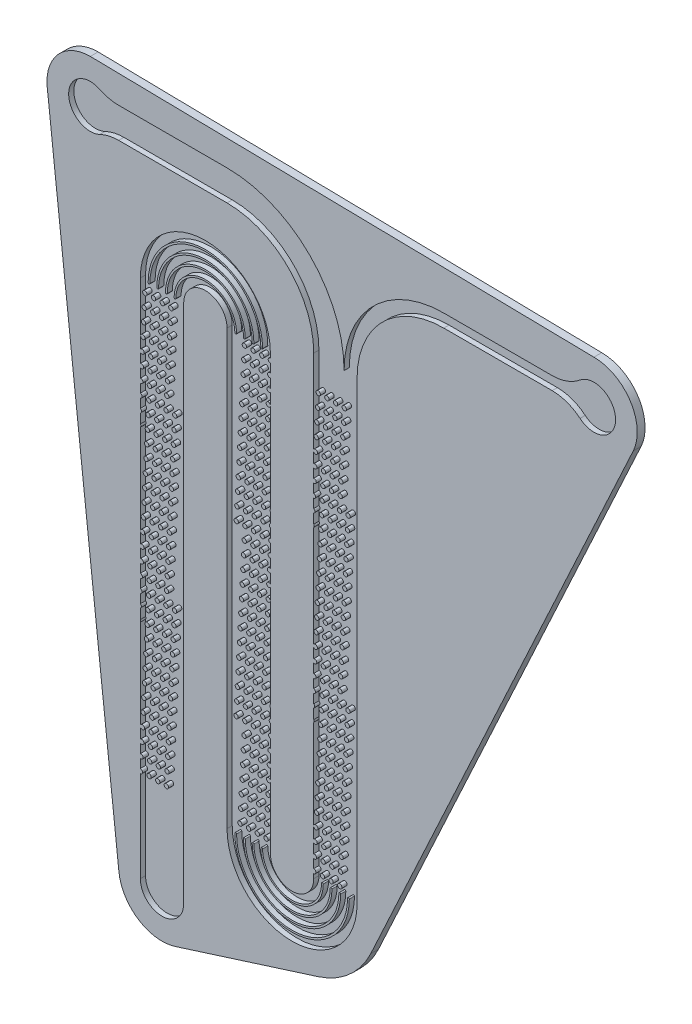
from build123d import *

# Parameters (mm, degrees)
MODEL_R                  = 0.5
BOSS_EXTRUDE1_DEPTH      = 1.2
BOSS_EXTRUDE2_DEPTH      = 1.2
BOSS_EXTRUDE2_DEPTH_BACK = 0.6


with BuildPart() as part:
    # Model → Boss-Extrude1 (new body)
    with BuildSketch(Plane.XY):
        with BuildLine():
            Line((0, 0), (0, 1))
            ThreePointArc((0, 1), (0.5, 1.5), (0, 2))
            Line((0, 2), (0, 4.025362431))
            ThreePointArc((0, 4.025362431), (0.657223338, 4.5), (0, 4.974637569))
            Line((0, 4.974637569), (0, 7.111254211))
            ThreePointArc((0, 7.111254211), (0.814446676, 7.5), (0, 7.888745789))
            Line((0, 7.888745789), (0, 10.334086172))
            ThreePointArc((0, 10.334086172), (0.971670014, 10.5), (0, 10.665913828))
            Line((0, 10.665913828), (0, 31.241126059))
            ThreePointArc((0, 31.241126059), (0.072233378, 31.5), (0, 31.758873941))
            Line((0, 31.758873941), (0, 34.07951655))
            ThreePointArc((0, 34.07951655), (0.229456716, 34.5), (0, 34.92048345))
            Line((0, 34.92048345), (0, 37.013010688))
            ThreePointArc((0, 37.013010688), (0.386680054, 37.5), (0, 37.986989312))
            Line((0, 37.986989312), (0, 40.001931238))
            ThreePointArc((0, 40.001931238), (0.498068762, 40.5), (0, 40.998068762))
            Line((0, 40.998068762), (0, 43.042235827))
            ThreePointArc((0, 43.042235827), (0.70112673, 43.5), (0, 43.957764173))
            Line((0, 43.957764173), (0, 46.151309265))
            ThreePointArc((0, 46.151309265), (0.858350068, 46.5), (0, 46.848690735))
            Line((0, 46.848690735), (0, 70.179611141))
            ThreePointArc((0, 70.179611141), (0.116136771, 70.5), (0, 70.820388859))
            Line((0, 70.820388859), (0, 73.054315852))
            ThreePointArc((0, 73.054315852), (0.273360108, 73.5), (0, 73.945684148))
            Line((0, 73.945684148), (0, 76.004842104))
            ThreePointArc((0, 76.004842104), (0.430583446, 76.5), (0, 76.995157896))
            Line((0, 76.995157896), (0, 79.007770411))
            ThreePointArc((0, 79.007770411), (0.587806784, 79.5), (0, 79.992229589))
            Line((0, 79.992229589), (0, 82.064155717))
            ThreePointArc((0, 82.064155717), (0.745030122, 82.5), (0, 82.935844283))
            Line((0, 82.935844283), (0, 85.203028361))
            ThreePointArc((0, 85.203028361), (0.90225346, 85.5), (0, 85.796971639))
            Line((0, 85.796971639), (0, 100))
            ThreePointArc((0, 100), (15, 115), (30, 100))
            Line((30, 100), (30, 99))
            ThreePointArc((30, 99), (29.5, 98.5), (30, 98))
            Line((30, 98), (30, 95.974637569))
            ThreePointArc((30, 95.974637569), (29.342776662, 95.5), (30, 95.025362431))
            Line((30, 95.025362431), (30, 92.888745789))
            ThreePointArc((30, 92.888745789), (29.185553324, 92.5), (30, 92.111254211))
            Line((30, 92.111254211), (30, 89.665913828))
            ThreePointArc((30, 89.665913828), (29.028329986, 89.5), (30, 89.334086172))
            Line((30, 89.334086172), (30, 68.758873941))
            ThreePointArc((30, 68.758873941), (29.927766622, 68.5), (30, 68.241126059))
            Line((30, 68.241126059), (30, 65.92048345))
            ThreePointArc((30, 65.92048345), (29.770543284, 65.5), (30, 65.07951655))
            Line((30, 65.07951655), (30, 62.986989312))
            ThreePointArc((30, 62.986989312), (29.613319946, 62.5), (30, 62.013010688))
            Line((30, 62.013010688), (30, 59.998068762))
            ThreePointArc((30, 59.998068762), (29.456096608, 59.5), (30, 59.001931238))
            Line((30, 59.001931238), (30, 56.957764173))
            ThreePointArc((30, 56.957764173), (29.29887327, 56.5), (30, 56.042235827))
            Line((30, 56.042235827), (30, 53.848690735))
            ThreePointArc((30, 53.848690735), (29.141649932, 53.5), (30, 53.151309265))
            Line((30, 53.151309265), (30, 29.820388859))
            ThreePointArc((30, 29.820388859), (29.883863229, 29.5), (30, 29.179611141))
            Line((30, 29.179611141), (30, 26.945684148))
            ThreePointArc((30, 26.945684148), (29.726639892, 26.5), (30, 26.054315852))
            Line((30, 26.054315852), (30, 23.995157896))
            ThreePointArc((30, 23.995157896), (29.569416554, 23.5), (30, 23.004842104))
            Line((30, 23.004842104), (30, 20.992229589))
            ThreePointArc((30, 20.992229589), (29.412193216, 20.5), (30, 20.007770411))
            Line((30, 20.007770411), (30, 17.935844283))
            ThreePointArc((30, 17.935844283), (29.254969878, 17.5), (30, 17.064155717))
            Line((30, 17.064155717), (30, 14.796971639))
            ThreePointArc((30, 14.796971639), (29.09774654, 14.5), (30, 14.203028361))
            Line((30, 14.203028361), (30, 0))
            ThreePointArc((30, 0), (35, -5), (40, 0))
            Line((40, 0), (40, 1))
            ThreePointArc((40, 1), (40.5, 1.5), (40, 2))
            Line((40, 2), (40, 4.025362431))
            ThreePointArc((40, 4.025362431), (40.657223338, 4.5), (40, 4.974637569))
            Line((40, 4.974637569), (40, 7.111254211))
            ThreePointArc((40, 7.111254211), (40.814446676, 7.5), (40, 7.888745789))
            Line((40, 7.888745789), (40, 10.334086172))
            ThreePointArc((40, 10.334086172), (40.971670014, 10.5), (40, 10.665913828))
            Line((40, 10.665913828), (40, 31.241126059))
            ThreePointArc((40, 31.241126059), (40.072233378, 31.5), (40, 31.758873941))
            Line((40, 31.758873941), (40, 34.07951655))
            ThreePointArc((40, 34.07951655), (40.229456716, 34.5), (40, 34.92048345))
            Line((40, 34.92048345), (40, 37.013010688))
            ThreePointArc((40, 37.013010688), (40.386680054, 37.5), (40, 37.986989312))
            Line((40, 37.986989312), (40, 40.001931238))
            ThreePointArc((40, 40.001931238), (40.543903392, 40.5), (40, 40.998068762))
            Line((40, 40.998068762), (40, 43.042235827))
            ThreePointArc((40, 43.042235827), (40.70112673, 43.5), (40, 43.957764173))
            Line((40, 43.957764173), (40, 46.151309265))
            ThreePointArc((40, 46.151309265), (40.858350068, 46.5), (40, 46.848690735))
            Line((40, 46.848690735), (40, 70.179611141))
            ThreePointArc((40, 70.179611141), (40.116136771, 70.5), (40, 70.820388859))
            Line((40, 70.820388859), (40, 73.054315852))
            ThreePointArc((40, 73.054315852), (40.273360108, 73.5), (40, 73.945684148))
            Line((40, 73.945684148), (40, 76.004842104))
            ThreePointArc((40, 76.004842104), (40.430583446, 76.5), (40, 76.995157896))
            Line((40, 76.995157896), (40, 79.007770411))
            ThreePointArc((40, 79.007770411), (40.587806784, 79.5), (40, 79.992229589))
            Line((40, 79.992229589), (40, 82.064155717))
            ThreePointArc((40, 82.064155717), (40.745030122, 82.5), (40, 82.935844283))
            Line((40, 82.935844283), (40, 85.203028361))
            ThreePointArc((40, 85.203028361), (40.90225346, 85.5), (40, 85.796971639))
            Line((40, 85.796971639), (40, 100))
            Line((40, 100), (40, 105))
            ThreePointArc((40, 105), (34.142135624, 119.142135624), (20, 125))
            Line((20, 125), (15, 125))
            Line((15, 125), (-5, 125))
            ThreePointArc((-5, 125), (-7.236067977, 124.746794345), (-9.358898944, 124))
            ThreePointArc((-9.358898944, 124), (-16.538348415, 128.5), (-9.358898944, 133))
            ThreePointArc((-9.358898944, 133), (-7.236067977, 132.253205655), (-5, 132))
            Line((-5, 132), (15, 132))
            Line((15, 132), (20, 132))
            ThreePointArc((20, 132), (39.091883092, 124.091883092), (47, 105))
            ThreePointArc((47, 105), (53.736544033, 121.263455967), (70, 128))
            Line((70, 128), (75, 128))
            Line((75, 128), (95, 128))
            ThreePointArc((95, 128), (98.415650255, 128.601418547), (101.420453428, 130.333333333))
            ThreePointArc((101.420453428, 130.333333333), (109.630680142, 126.5), (101.420453428, 122.666666667))
            ThreePointArc((101.420453428, 122.666666667), (98.415650255, 124.398581453), (95, 125))
            Line((95, 125), (75, 125))
            Line((75, 125), (70, 125))
            ThreePointArc((70, 125), (55.857864376, 119.142135624), (50, 105))
            Line((50, 105), (50, 100))
            Line((50, 100), (50, 0))
            ThreePointArc((50, 0), (35, -15), (20, 0))
            Line((20, 0), (20, 100))
            ThreePointArc((20, 100), (15, 105), (10, 100))
            Line((10, 100), (10, 0))
            Line((10, 0), (10, -20))
            ThreePointArc((10, -20), (5, -25), (0, -20))
            Line((0, -20), (0, 0))
        make_face()
        with Locations((2, 1.5)):
            Circle(MODEL_R, mode=Mode.SUBTRACT)
        with Locations((4, 1.5)):
            Circle(MODEL_R, mode=Mode.SUBTRACT)
        with Locations((6, 1.5)):
            Circle(MODEL_R, mode=Mode.SUBTRACT)
        with Locations((2.157223338, 4.5)):
            Circle(MODEL_R, mode=Mode.SUBTRACT)
        with Locations((4.157223338, 4.5)):
            Circle(MODEL_R, mode=Mode.SUBTRACT)
        with Locations((6.157223338, 4.5)):
            Circle(MODEL_R, mode=Mode.SUBTRACT)
        with Locations((2.314446676, 7.5)):
            Circle(MODEL_R, mode=Mode.SUBTRACT)
        with Locations((4.314446676, 7.5)):
            Circle(MODEL_R, mode=Mode.SUBTRACT)
        with Locations((6.314446676, 7.5)):
            Circle(MODEL_R, mode=Mode.SUBTRACT)
        with Locations((2.471670014, 10.5)):
            Circle(MODEL_R, mode=Mode.SUBTRACT)
        with Locations((4.471670014, 10.5)):
            Circle(MODEL_R, mode=Mode.SUBTRACT)
        with Locations((6.471670014, 10.5)):
            Circle(MODEL_R, mode=Mode.SUBTRACT)
        with Locations((0.628893351, 13.5)):
            Circle(MODEL_R, mode=Mode.SUBTRACT)
        with Locations((2.628893351, 13.5)):
            Circle(MODEL_R, mode=Mode.SUBTRACT)
        with Locations((4.628893351, 13.5)):
            Circle(MODEL_R, mode=Mode.SUBTRACT)
        with Locations((6.628893351, 13.5)):
            Circle(MODEL_R, mode=Mode.SUBTRACT)
        with Locations((0.786116689, 16.5)):
            Circle(MODEL_R, mode=Mode.SUBTRACT)
        with Locations((2.786116689, 16.5)):
            Circle(MODEL_R, mode=Mode.SUBTRACT)
        with Locations((4.786116689, 16.5)):
            Circle(MODEL_R, mode=Mode.SUBTRACT)
        with Locations((6.786116689, 16.5)):
            Circle(MODEL_R, mode=Mode.SUBTRACT)
        with Locations((0.943340027, 19.5)):
            Circle(MODEL_R, mode=Mode.SUBTRACT)
        with Locations((2.943340027, 19.5)):
            Circle(MODEL_R, mode=Mode.SUBTRACT)
        with Locations((4.943340027, 19.5)):
            Circle(MODEL_R, mode=Mode.SUBTRACT)
        with Locations((6.943340027, 19.5)):
            Circle(MODEL_R, mode=Mode.SUBTRACT)
        with Locations((1.100563365, 22.5)):
            Circle(MODEL_R, mode=Mode.SUBTRACT)
        with Locations((3.100563365, 22.5)):
            Circle(MODEL_R, mode=Mode.SUBTRACT)
        with Locations((5.100563365, 22.5)):
            Circle(MODEL_R, mode=Mode.SUBTRACT)
        with Locations((7.100563365, 22.5)):
            Circle(MODEL_R, mode=Mode.SUBTRACT)
        with Locations((1.257786703, 25.5)):
            Circle(MODEL_R, mode=Mode.SUBTRACT)
        with Locations((3.257786703, 25.5)):
            Circle(MODEL_R, mode=Mode.SUBTRACT)
        with Locations((5.257786703, 25.5)):
            Circle(MODEL_R, mode=Mode.SUBTRACT)
        with Locations((7.257786703, 25.5)):
            Circle(MODEL_R, mode=Mode.SUBTRACT)
        with Locations((1.415010041, 28.5)):
            Circle(MODEL_R, mode=Mode.SUBTRACT)
        with Locations((3.415010041, 28.5)):
            Circle(MODEL_R, mode=Mode.SUBTRACT)
        with Locations((5.415010041, 28.5)):
            Circle(MODEL_R, mode=Mode.SUBTRACT)
        with Locations((7.415010041, 28.5)):
            Circle(MODEL_R, mode=Mode.SUBTRACT)
        with Locations((1.572233378, 31.5)):
            Circle(MODEL_R, mode=Mode.SUBTRACT)
        with Locations((3.572233378, 31.5)):
            Circle(MODEL_R, mode=Mode.SUBTRACT)
        with Locations((5.572233378, 31.5)):
            Circle(MODEL_R, mode=Mode.SUBTRACT)
        with Locations((7.572233378, 31.5)):
            Circle(MODEL_R, mode=Mode.SUBTRACT)
        with Locations((1.729456716, 34.5)):
            Circle(MODEL_R, mode=Mode.SUBTRACT)
        with Locations((3.729456716, 34.5)):
            Circle(MODEL_R, mode=Mode.SUBTRACT)
        with Locations((5.729456716, 34.5)):
            Circle(MODEL_R, mode=Mode.SUBTRACT)
        with Locations((7.729456716, 34.5)):
            Circle(MODEL_R, mode=Mode.SUBTRACT)
        with Locations((1.886680054, 37.5)):
            Circle(MODEL_R, mode=Mode.SUBTRACT)
        with Locations((3.886680054, 37.5)):
            Circle(MODEL_R, mode=Mode.SUBTRACT)
        with Locations((5.886680054, 37.5)):
            Circle(MODEL_R, mode=Mode.SUBTRACT)
        with Locations((7.886680054, 37.5)):
            Circle(MODEL_R, mode=Mode.SUBTRACT)
        with Locations((2.043903392, 40.5)):
            Circle(MODEL_R, mode=Mode.SUBTRACT)
        with Locations((4.043903392, 40.5)):
            Circle(MODEL_R, mode=Mode.SUBTRACT)
        with Locations((6.043903392, 40.5)):
            Circle(MODEL_R, mode=Mode.SUBTRACT)
        with Locations((2.20112673, 43.5)):
            Circle(MODEL_R, mode=Mode.SUBTRACT)
        with Locations((4.20112673, 43.5)):
            Circle(MODEL_R, mode=Mode.SUBTRACT)
        with Locations((6.20112673, 43.5)):
            Circle(MODEL_R, mode=Mode.SUBTRACT)
        with Locations((2.358350068, 46.5)):
            Circle(MODEL_R, mode=Mode.SUBTRACT)
        with Locations((4.358350068, 46.5)):
            Circle(MODEL_R, mode=Mode.SUBTRACT)
        with Locations((6.358350068, 46.5)):
            Circle(MODEL_R, mode=Mode.SUBTRACT)
        with Locations((0.515573406, 49.5)):
            Circle(MODEL_R, mode=Mode.SUBTRACT)
        with Locations((2.515573406, 49.5)):
            Circle(MODEL_R, mode=Mode.SUBTRACT)
        with Locations((4.515573406, 49.5)):
            Circle(MODEL_R, mode=Mode.SUBTRACT)
        with Locations((6.515573406, 49.5)):
            Circle(MODEL_R, mode=Mode.SUBTRACT)
        with Locations((0.672796743, 52.5)):
            Circle(MODEL_R, mode=Mode.SUBTRACT)
        with Locations((2.672796743, 52.5)):
            Circle(MODEL_R, mode=Mode.SUBTRACT)
        with Locations((4.672796743, 52.5)):
            Circle(MODEL_R, mode=Mode.SUBTRACT)
        with Locations((6.672796743, 52.5)):
            Circle(MODEL_R, mode=Mode.SUBTRACT)
        with Locations((0.830020081, 55.5)):
            Circle(MODEL_R, mode=Mode.SUBTRACT)
        with Locations((2.830020081, 55.5)):
            Circle(MODEL_R, mode=Mode.SUBTRACT)
        with Locations((4.830020081, 55.5)):
            Circle(MODEL_R, mode=Mode.SUBTRACT)
        with Locations((6.830020081, 55.5)):
            Circle(MODEL_R, mode=Mode.SUBTRACT)
        with Locations((0.987243419, 58.5)):
            Circle(MODEL_R, mode=Mode.SUBTRACT)
        with Locations((2.987243419, 58.5)):
            Circle(MODEL_R, mode=Mode.SUBTRACT)
        with Locations((4.987243419, 58.5)):
            Circle(MODEL_R, mode=Mode.SUBTRACT)
        with Locations((6.987243419, 58.5)):
            Circle(MODEL_R, mode=Mode.SUBTRACT)
        with Locations((1.144466757, 61.5)):
            Circle(MODEL_R, mode=Mode.SUBTRACT)
        with Locations((3.144466757, 61.5)):
            Circle(MODEL_R, mode=Mode.SUBTRACT)
        with Locations((5.144466757, 61.5)):
            Circle(MODEL_R, mode=Mode.SUBTRACT)
        with Locations((7.144466757, 61.5)):
            Circle(MODEL_R, mode=Mode.SUBTRACT)
        with Locations((1.301690095, 64.5)):
            Circle(MODEL_R, mode=Mode.SUBTRACT)
        with Locations((3.301690095, 64.5)):
            Circle(MODEL_R, mode=Mode.SUBTRACT)
        with Locations((5.301690095, 64.5)):
            Circle(MODEL_R, mode=Mode.SUBTRACT)
        with Locations((7.301690095, 64.5)):
            Circle(MODEL_R, mode=Mode.SUBTRACT)
        with Locations((1.458913433, 67.5)):
            Circle(MODEL_R, mode=Mode.SUBTRACT)
        with Locations((3.458913433, 67.5)):
            Circle(MODEL_R, mode=Mode.SUBTRACT)
        with Locations((5.458913433, 67.5)):
            Circle(MODEL_R, mode=Mode.SUBTRACT)
        with Locations((7.458913433, 67.5)):
            Circle(MODEL_R, mode=Mode.SUBTRACT)
        with Locations((1.616136771, 70.5)):
            Circle(MODEL_R, mode=Mode.SUBTRACT)
        with Locations((3.616136771, 70.5)):
            Circle(MODEL_R, mode=Mode.SUBTRACT)
        with Locations((5.616136771, 70.5)):
            Circle(MODEL_R, mode=Mode.SUBTRACT)
        with Locations((7.616136771, 70.5)):
            Circle(MODEL_R, mode=Mode.SUBTRACT)
        with Locations((1.773360108, 73.5)):
            Circle(MODEL_R, mode=Mode.SUBTRACT)
        with Locations((3.773360108, 73.5)):
            Circle(MODEL_R, mode=Mode.SUBTRACT)
        with Locations((5.773360108, 73.5)):
            Circle(MODEL_R, mode=Mode.SUBTRACT)
        with Locations((7.773360108, 73.5)):
            Circle(MODEL_R, mode=Mode.SUBTRACT)
        with Locations((1.930583446, 76.5)):
            Circle(MODEL_R, mode=Mode.SUBTRACT)
        with Locations((3.930583446, 76.5)):
            Circle(MODEL_R, mode=Mode.SUBTRACT)
        with Locations((5.930583446, 76.5)):
            Circle(MODEL_R, mode=Mode.SUBTRACT)
        with Locations((7.930583446, 76.5)):
            Circle(MODEL_R, mode=Mode.SUBTRACT)
        with Locations((2.087806784, 79.5)):
            Circle(MODEL_R, mode=Mode.SUBTRACT)
        with Locations((4.087806784, 79.5)):
            Circle(MODEL_R, mode=Mode.SUBTRACT)
        with Locations((6.087806784, 79.5)):
            Circle(MODEL_R, mode=Mode.SUBTRACT)
        with Locations((2.245030122, 82.5)):
            Circle(MODEL_R, mode=Mode.SUBTRACT)
        with Locations((4.245030122, 82.5)):
            Circle(MODEL_R, mode=Mode.SUBTRACT)
        with Locations((6.245030122, 82.5)):
            Circle(MODEL_R, mode=Mode.SUBTRACT)
        with Locations((2.40225346, 85.5)):
            Circle(MODEL_R, mode=Mode.SUBTRACT)
        with Locations((4.40225346, 85.5)):
            Circle(MODEL_R, mode=Mode.SUBTRACT)
        with Locations((6.40225346, 85.5)):
            Circle(MODEL_R, mode=Mode.SUBTRACT)
        with Locations((0.559476798, 88.5)):
            Circle(MODEL_R, mode=Mode.SUBTRACT)
        with Locations((2.559476798, 88.5)):
            Circle(MODEL_R, mode=Mode.SUBTRACT)
        with Locations((4.559476798, 88.5)):
            Circle(MODEL_R, mode=Mode.SUBTRACT)
        with Locations((6.559476798, 88.5)):
            Circle(MODEL_R, mode=Mode.SUBTRACT)
        with Locations((0.716700135, 91.5)):
            Circle(MODEL_R, mode=Mode.SUBTRACT)
        with Locations((2.716700135, 91.5)):
            Circle(MODEL_R, mode=Mode.SUBTRACT)
        with Locations((4.716700135, 91.5)):
            Circle(MODEL_R, mode=Mode.SUBTRACT)
        with Locations((6.716700135, 91.5)):
            Circle(MODEL_R, mode=Mode.SUBTRACT)
        with Locations((0.873923473, 94.5)):
            Circle(MODEL_R, mode=Mode.SUBTRACT)
        with Locations((2.873923473, 94.5)):
            Circle(MODEL_R, mode=Mode.SUBTRACT)
        with Locations((4.873923473, 94.5)):
            Circle(MODEL_R, mode=Mode.SUBTRACT)
        with Locations((6.873923473, 94.5)):
            Circle(MODEL_R, mode=Mode.SUBTRACT)
        with Locations((1.031146811, 97.5)):
            Circle(MODEL_R, mode=Mode.SUBTRACT)
        with Locations((3.031146811, 97.5)):
            Circle(MODEL_R, mode=Mode.SUBTRACT)
        with Locations((5.031146811, 97.5)):
            Circle(MODEL_R, mode=Mode.SUBTRACT)
        with Locations((7.031146811, 97.5)):
            Circle(MODEL_R, mode=Mode.SUBTRACT)
        with Locations((28, 98.5)):
            Circle(MODEL_R, mode=Mode.SUBTRACT)
        with Locations((26, 98.5)):
            Circle(MODEL_R, mode=Mode.SUBTRACT)
        with Locations((24, 98.5)):
            Circle(MODEL_R, mode=Mode.SUBTRACT)
        with Locations((27.842776662, 95.5)):
            Circle(MODEL_R, mode=Mode.SUBTRACT)
        with Locations((25.842776662, 95.5)):
            Circle(MODEL_R, mode=Mode.SUBTRACT)
        with Locations((23.842776662, 95.5)):
            Circle(MODEL_R, mode=Mode.SUBTRACT)
        with Locations((27.685553324, 92.5)):
            Circle(MODEL_R, mode=Mode.SUBTRACT)
        with Locations((25.685553324, 92.5)):
            Circle(MODEL_R, mode=Mode.SUBTRACT)
        with Locations((23.685553324, 92.5)):
            Circle(MODEL_R, mode=Mode.SUBTRACT)
        with Locations((27.528329986, 89.5)):
            Circle(MODEL_R, mode=Mode.SUBTRACT)
        with Locations((25.528329986, 89.5)):
            Circle(MODEL_R, mode=Mode.SUBTRACT)
        with Locations((23.528329986, 89.5)):
            Circle(MODEL_R, mode=Mode.SUBTRACT)
        with Locations((29.371106649, 86.5)):
            Circle(MODEL_R, mode=Mode.SUBTRACT)
        with Locations((27.371106649, 86.5)):
            Circle(MODEL_R, mode=Mode.SUBTRACT)
        with Locations((25.371106649, 86.5)):
            Circle(MODEL_R, mode=Mode.SUBTRACT)
        with Locations((23.371106649, 86.5)):
            Circle(MODEL_R, mode=Mode.SUBTRACT)
        with Locations((29.213883311, 83.5)):
            Circle(MODEL_R, mode=Mode.SUBTRACT)
        with Locations((27.213883311, 83.5)):
            Circle(MODEL_R, mode=Mode.SUBTRACT)
        with Locations((25.213883311, 83.5)):
            Circle(MODEL_R, mode=Mode.SUBTRACT)
        with Locations((23.213883311, 83.5)):
            Circle(MODEL_R, mode=Mode.SUBTRACT)
        with Locations((29.056659973, 80.5)):
            Circle(MODEL_R, mode=Mode.SUBTRACT)
        with Locations((27.056659973, 80.5)):
            Circle(MODEL_R, mode=Mode.SUBTRACT)
        with Locations((25.056659973, 80.5)):
            Circle(MODEL_R, mode=Mode.SUBTRACT)
        with Locations((23.056659973, 80.5)):
            Circle(MODEL_R, mode=Mode.SUBTRACT)
        with Locations((28.899436635, 77.5)):
            Circle(MODEL_R, mode=Mode.SUBTRACT)
        with Locations((26.899436635, 77.5)):
            Circle(MODEL_R, mode=Mode.SUBTRACT)
        with Locations((24.899436635, 77.5)):
            Circle(MODEL_R, mode=Mode.SUBTRACT)
        with Locations((22.899436635, 77.5)):
            Circle(MODEL_R, mode=Mode.SUBTRACT)
        with Locations((28.742213297, 74.5)):
            Circle(MODEL_R, mode=Mode.SUBTRACT)
        with Locations((26.742213297, 74.5)):
            Circle(MODEL_R, mode=Mode.SUBTRACT)
        with Locations((24.742213297, 74.5)):
            Circle(MODEL_R, mode=Mode.SUBTRACT)
        with Locations((22.742213297, 74.5)):
            Circle(MODEL_R, mode=Mode.SUBTRACT)
        with Locations((28.584989959, 71.5)):
            Circle(MODEL_R, mode=Mode.SUBTRACT)
        with Locations((26.584989959, 71.5)):
            Circle(MODEL_R, mode=Mode.SUBTRACT)
        with Locations((24.584989959, 71.5)):
            Circle(MODEL_R, mode=Mode.SUBTRACT)
        with Locations((22.584989959, 71.5)):
            Circle(MODEL_R, mode=Mode.SUBTRACT)
        with Locations((28.427766622, 68.5)):
            Circle(MODEL_R, mode=Mode.SUBTRACT)
        with Locations((26.427766622, 68.5)):
            Circle(MODEL_R, mode=Mode.SUBTRACT)
        with Locations((24.427766622, 68.5)):
            Circle(MODEL_R, mode=Mode.SUBTRACT)
        with Locations((22.427766622, 68.5)):
            Circle(MODEL_R, mode=Mode.SUBTRACT)
        with Locations((28.270543284, 65.5)):
            Circle(MODEL_R, mode=Mode.SUBTRACT)
        with Locations((26.270543284, 65.5)):
            Circle(MODEL_R, mode=Mode.SUBTRACT)
        with Locations((24.270543284, 65.5)):
            Circle(MODEL_R, mode=Mode.SUBTRACT)
        with Locations((22.270543284, 65.5)):
            Circle(MODEL_R, mode=Mode.SUBTRACT)
        with Locations((28.113319946, 62.5)):
            Circle(MODEL_R, mode=Mode.SUBTRACT)
        with Locations((26.113319946, 62.5)):
            Circle(MODEL_R, mode=Mode.SUBTRACT)
        with Locations((24.113319946, 62.5)):
            Circle(MODEL_R, mode=Mode.SUBTRACT)
        with Locations((22.113319946, 62.5)):
            Circle(MODEL_R, mode=Mode.SUBTRACT)
        with Locations((27.956096608, 59.5)):
            Circle(MODEL_R, mode=Mode.SUBTRACT)
        with Locations((25.956096608, 59.5)):
            Circle(MODEL_R, mode=Mode.SUBTRACT)
        with Locations((23.956096608, 59.5)):
            Circle(MODEL_R, mode=Mode.SUBTRACT)
        with Locations((27.79887327, 56.5)):
            Circle(MODEL_R, mode=Mode.SUBTRACT)
        with Locations((25.79887327, 56.5)):
            Circle(MODEL_R, mode=Mode.SUBTRACT)
        with Locations((23.79887327, 56.5)):
            Circle(MODEL_R, mode=Mode.SUBTRACT)
        with Locations((27.641649932, 53.5)):
            Circle(MODEL_R, mode=Mode.SUBTRACT)
        with Locations((25.641649932, 53.5)):
            Circle(MODEL_R, mode=Mode.SUBTRACT)
        with Locations((23.641649932, 53.5)):
            Circle(MODEL_R, mode=Mode.SUBTRACT)
        with Locations((29.484426594, 50.5)):
            Circle(MODEL_R, mode=Mode.SUBTRACT)
        with Locations((27.484426594, 50.5)):
            Circle(MODEL_R, mode=Mode.SUBTRACT)
        with Locations((25.484426594, 50.5)):
            Circle(MODEL_R, mode=Mode.SUBTRACT)
        with Locations((23.484426594, 50.5)):
            Circle(MODEL_R, mode=Mode.SUBTRACT)
        with Locations((29.327203257, 47.5)):
            Circle(MODEL_R, mode=Mode.SUBTRACT)
        with Locations((27.327203257, 47.5)):
            Circle(MODEL_R, mode=Mode.SUBTRACT)
        with Locations((25.327203257, 47.5)):
            Circle(MODEL_R, mode=Mode.SUBTRACT)
        with Locations((23.327203257, 47.5)):
            Circle(MODEL_R, mode=Mode.SUBTRACT)
        with Locations((29.169979919, 44.5)):
            Circle(MODEL_R, mode=Mode.SUBTRACT)
        with Locations((27.169979919, 44.5)):
            Circle(MODEL_R, mode=Mode.SUBTRACT)
        with Locations((25.169979919, 44.5)):
            Circle(MODEL_R, mode=Mode.SUBTRACT)
        with Locations((23.169979919, 44.5)):
            Circle(MODEL_R, mode=Mode.SUBTRACT)
        with Locations((29.012756581, 41.5)):
            Circle(MODEL_R, mode=Mode.SUBTRACT)
        with Locations((27.012756581, 41.5)):
            Circle(MODEL_R, mode=Mode.SUBTRACT)
        with Locations((25.012756581, 41.5)):
            Circle(MODEL_R, mode=Mode.SUBTRACT)
        with Locations((23.012756581, 41.5)):
            Circle(MODEL_R, mode=Mode.SUBTRACT)
        with Locations((28.855533243, 38.5)):
            Circle(MODEL_R, mode=Mode.SUBTRACT)
        with Locations((26.855533243, 38.5)):
            Circle(MODEL_R, mode=Mode.SUBTRACT)
        with Locations((24.855533243, 38.5)):
            Circle(MODEL_R, mode=Mode.SUBTRACT)
        with Locations((22.855533243, 38.5)):
            Circle(MODEL_R, mode=Mode.SUBTRACT)
        with Locations((28.698309905, 35.5)):
            Circle(MODEL_R, mode=Mode.SUBTRACT)
        with Locations((26.698309905, 35.5)):
            Circle(MODEL_R, mode=Mode.SUBTRACT)
        with Locations((24.698309905, 35.5)):
            Circle(MODEL_R, mode=Mode.SUBTRACT)
        with Locations((22.698309905, 35.5)):
            Circle(MODEL_R, mode=Mode.SUBTRACT)
        with Locations((28.541086567, 32.5)):
            Circle(MODEL_R, mode=Mode.SUBTRACT)
        with Locations((26.541086567, 32.5)):
            Circle(MODEL_R, mode=Mode.SUBTRACT)
        with Locations((24.541086567, 32.5)):
            Circle(MODEL_R, mode=Mode.SUBTRACT)
        with Locations((22.541086567, 32.5)):
            Circle(MODEL_R, mode=Mode.SUBTRACT)
        with Locations((28.383863229, 29.5)):
            Circle(MODEL_R, mode=Mode.SUBTRACT)
        with Locations((26.383863229, 29.5)):
            Circle(MODEL_R, mode=Mode.SUBTRACT)
        with Locations((24.383863229, 29.5)):
            Circle(MODEL_R, mode=Mode.SUBTRACT)
        with Locations((22.383863229, 29.5)):
            Circle(MODEL_R, mode=Mode.SUBTRACT)
        with Locations((28.226639892, 26.5)):
            Circle(MODEL_R, mode=Mode.SUBTRACT)
        with Locations((26.226639892, 26.5)):
            Circle(MODEL_R, mode=Mode.SUBTRACT)
        with Locations((24.226639892, 26.5)):
            Circle(MODEL_R, mode=Mode.SUBTRACT)
        with Locations((22.226639892, 26.5)):
            Circle(MODEL_R, mode=Mode.SUBTRACT)
        with Locations((28.069416554, 23.5)):
            Circle(MODEL_R, mode=Mode.SUBTRACT)
        with Locations((26.069416554, 23.5)):
            Circle(MODEL_R, mode=Mode.SUBTRACT)
        with Locations((24.069416554, 23.5)):
            Circle(MODEL_R, mode=Mode.SUBTRACT)
        with Locations((22.069416554, 23.5)):
            Circle(MODEL_R, mode=Mode.SUBTRACT)
        with Locations((27.912193216, 20.5)):
            Circle(MODEL_R, mode=Mode.SUBTRACT)
        with Locations((25.912193216, 20.5)):
            Circle(MODEL_R, mode=Mode.SUBTRACT)
        with Locations((23.912193216, 20.5)):
            Circle(MODEL_R, mode=Mode.SUBTRACT)
        with Locations((27.754969878, 17.5)):
            Circle(MODEL_R, mode=Mode.SUBTRACT)
        with Locations((25.754969878, 17.5)):
            Circle(MODEL_R, mode=Mode.SUBTRACT)
        with Locations((23.754969878, 17.5)):
            Circle(MODEL_R, mode=Mode.SUBTRACT)
        with Locations((27.59774654, 14.5)):
            Circle(MODEL_R, mode=Mode.SUBTRACT)
        with Locations((25.59774654, 14.5)):
            Circle(MODEL_R, mode=Mode.SUBTRACT)
        with Locations((23.59774654, 14.5)):
            Circle(MODEL_R, mode=Mode.SUBTRACT)
        with Locations((29.440523202, 11.5)):
            Circle(MODEL_R, mode=Mode.SUBTRACT)
        with Locations((27.440523202, 11.5)):
            Circle(MODEL_R, mode=Mode.SUBTRACT)
        with Locations((25.440523202, 11.5)):
            Circle(MODEL_R, mode=Mode.SUBTRACT)
        with Locations((23.440523202, 11.5)):
            Circle(MODEL_R, mode=Mode.SUBTRACT)
        with Locations((29.283299865, 8.5)):
            Circle(MODEL_R, mode=Mode.SUBTRACT)
        with Locations((27.283299865, 8.5)):
            Circle(MODEL_R, mode=Mode.SUBTRACT)
        with Locations((25.283299865, 8.5)):
            Circle(MODEL_R, mode=Mode.SUBTRACT)
        with Locations((23.283299865, 8.5)):
            Circle(MODEL_R, mode=Mode.SUBTRACT)
        with Locations((29.126076527, 5.5)):
            Circle(MODEL_R, mode=Mode.SUBTRACT)
        with Locations((27.126076527, 5.5)):
            Circle(MODEL_R, mode=Mode.SUBTRACT)
        with Locations((25.126076527, 5.5)):
            Circle(MODEL_R, mode=Mode.SUBTRACT)
        with Locations((23.126076527, 5.5)):
            Circle(MODEL_R, mode=Mode.SUBTRACT)
        with Locations((28.968853189, 2.5)):
            Circle(MODEL_R, mode=Mode.SUBTRACT)
        with Locations((26.968853189, 2.5)):
            Circle(MODEL_R, mode=Mode.SUBTRACT)
        with Locations((24.968853189, 2.5)):
            Circle(MODEL_R, mode=Mode.SUBTRACT)
        with Locations((22.968853189, 2.5)):
            Circle(MODEL_R, mode=Mode.SUBTRACT)
        with Locations((42, 1.5)):
            Circle(MODEL_R, mode=Mode.SUBTRACT)
        with Locations((44, 1.5)):
            Circle(MODEL_R, mode=Mode.SUBTRACT)
        with Locations((46, 1.5)):
            Circle(MODEL_R, mode=Mode.SUBTRACT)
        with Locations((42.157223338, 4.5)):
            Circle(MODEL_R, mode=Mode.SUBTRACT)
        with Locations((44.157223338, 4.5)):
            Circle(MODEL_R, mode=Mode.SUBTRACT)
        with Locations((46.157223338, 4.5)):
            Circle(MODEL_R, mode=Mode.SUBTRACT)
        with Locations((42.314446676, 7.5)):
            Circle(MODEL_R, mode=Mode.SUBTRACT)
        with Locations((44.314446676, 7.5)):
            Circle(MODEL_R, mode=Mode.SUBTRACT)
        with Locations((46.314446676, 7.5)):
            Circle(MODEL_R, mode=Mode.SUBTRACT)
        with Locations((42.471670014, 10.5)):
            Circle(MODEL_R, mode=Mode.SUBTRACT)
        with Locations((44.471670014, 10.5)):
            Circle(MODEL_R, mode=Mode.SUBTRACT)
        with Locations((46.471670014, 10.5)):
            Circle(MODEL_R, mode=Mode.SUBTRACT)
        with Locations((40.628893351, 13.5)):
            Circle(MODEL_R, mode=Mode.SUBTRACT)
        with Locations((42.628893351, 13.5)):
            Circle(MODEL_R, mode=Mode.SUBTRACT)
        with Locations((44.628893351, 13.5)):
            Circle(MODEL_R, mode=Mode.SUBTRACT)
        with Locations((46.628893351, 13.5)):
            Circle(MODEL_R, mode=Mode.SUBTRACT)
        with Locations((40.786116689, 16.5)):
            Circle(MODEL_R, mode=Mode.SUBTRACT)
        with Locations((42.786116689, 16.5)):
            Circle(MODEL_R, mode=Mode.SUBTRACT)
        with Locations((44.786116689, 16.5)):
            Circle(MODEL_R, mode=Mode.SUBTRACT)
        with Locations((46.786116689, 16.5)):
            Circle(MODEL_R, mode=Mode.SUBTRACT)
        with Locations((40.943340027, 19.5)):
            Circle(MODEL_R, mode=Mode.SUBTRACT)
        with Locations((42.943340027, 19.5)):
            Circle(MODEL_R, mode=Mode.SUBTRACT)
        with Locations((44.943340027, 19.5)):
            Circle(MODEL_R, mode=Mode.SUBTRACT)
        with Locations((46.943340027, 19.5)):
            Circle(MODEL_R, mode=Mode.SUBTRACT)
        with Locations((41.100563365, 22.5)):
            Circle(MODEL_R, mode=Mode.SUBTRACT)
        with Locations((43.100563365, 22.5)):
            Circle(MODEL_R, mode=Mode.SUBTRACT)
        with Locations((45.100563365, 22.5)):
            Circle(MODEL_R, mode=Mode.SUBTRACT)
        with Locations((47.100563365, 22.5)):
            Circle(MODEL_R, mode=Mode.SUBTRACT)
        with Locations((41.257786703, 25.5)):
            Circle(MODEL_R, mode=Mode.SUBTRACT)
        with Locations((43.257786703, 25.5)):
            Circle(MODEL_R, mode=Mode.SUBTRACT)
        with Locations((45.257786703, 25.5)):
            Circle(MODEL_R, mode=Mode.SUBTRACT)
        with Locations((47.257786703, 25.5)):
            Circle(MODEL_R, mode=Mode.SUBTRACT)
        with Locations((41.415010041, 28.5)):
            Circle(MODEL_R, mode=Mode.SUBTRACT)
        with Locations((43.415010041, 28.5)):
            Circle(MODEL_R, mode=Mode.SUBTRACT)
        with Locations((45.415010041, 28.5)):
            Circle(MODEL_R, mode=Mode.SUBTRACT)
        with Locations((47.415010041, 28.5)):
            Circle(MODEL_R, mode=Mode.SUBTRACT)
        with Locations((41.572233378, 31.5)):
            Circle(MODEL_R, mode=Mode.SUBTRACT)
        with Locations((43.572233378, 31.5)):
            Circle(MODEL_R, mode=Mode.SUBTRACT)
        with Locations((45.572233378, 31.5)):
            Circle(MODEL_R, mode=Mode.SUBTRACT)
        with Locations((47.572233378, 31.5)):
            Circle(MODEL_R, mode=Mode.SUBTRACT)
        with Locations((41.729456716, 34.5)):
            Circle(MODEL_R, mode=Mode.SUBTRACT)
        with Locations((43.729456716, 34.5)):
            Circle(MODEL_R, mode=Mode.SUBTRACT)
        with Locations((45.729456716, 34.5)):
            Circle(MODEL_R, mode=Mode.SUBTRACT)
        with Locations((47.729456716, 34.5)):
            Circle(MODEL_R, mode=Mode.SUBTRACT)
        with Locations((41.886680054, 37.5)):
            Circle(MODEL_R, mode=Mode.SUBTRACT)
        with Locations((43.886680054, 37.5)):
            Circle(MODEL_R, mode=Mode.SUBTRACT)
        with Locations((45.886680054, 37.5)):
            Circle(MODEL_R, mode=Mode.SUBTRACT)
        with Locations((47.886680054, 37.5)):
            Circle(MODEL_R, mode=Mode.SUBTRACT)
        with Locations((42.043903392, 40.5)):
            Circle(MODEL_R, mode=Mode.SUBTRACT)
        with Locations((44.043903392, 40.5)):
            Circle(MODEL_R, mode=Mode.SUBTRACT)
        with Locations((46.043903392, 40.5)):
            Circle(MODEL_R, mode=Mode.SUBTRACT)
        with Locations((42.20112673, 43.5)):
            Circle(MODEL_R, mode=Mode.SUBTRACT)
        with Locations((44.20112673, 43.5)):
            Circle(MODEL_R, mode=Mode.SUBTRACT)
        with Locations((46.20112673, 43.5)):
            Circle(MODEL_R, mode=Mode.SUBTRACT)
        with Locations((42.358350068, 46.5)):
            Circle(MODEL_R, mode=Mode.SUBTRACT)
        with Locations((44.358350068, 46.5)):
            Circle(MODEL_R, mode=Mode.SUBTRACT)
        with Locations((46.358350068, 46.5)):
            Circle(MODEL_R, mode=Mode.SUBTRACT)
        with Locations((40.515573406, 49.5)):
            Circle(MODEL_R, mode=Mode.SUBTRACT)
        with Locations((42.515573406, 49.5)):
            Circle(MODEL_R, mode=Mode.SUBTRACT)
        with Locations((44.515573406, 49.5)):
            Circle(MODEL_R, mode=Mode.SUBTRACT)
        with Locations((46.515573406, 49.5)):
            Circle(MODEL_R, mode=Mode.SUBTRACT)
        with Locations((40.672796743, 52.5)):
            Circle(MODEL_R, mode=Mode.SUBTRACT)
        with Locations((42.672796743, 52.5)):
            Circle(MODEL_R, mode=Mode.SUBTRACT)
        with Locations((44.672796743, 52.5)):
            Circle(MODEL_R, mode=Mode.SUBTRACT)
        with Locations((46.672796743, 52.5)):
            Circle(MODEL_R, mode=Mode.SUBTRACT)
        with Locations((40.830020081, 55.5)):
            Circle(MODEL_R, mode=Mode.SUBTRACT)
        with Locations((42.830020081, 55.5)):
            Circle(MODEL_R, mode=Mode.SUBTRACT)
        with Locations((44.830020081, 55.5)):
            Circle(MODEL_R, mode=Mode.SUBTRACT)
        with Locations((46.830020081, 55.5)):
            Circle(MODEL_R, mode=Mode.SUBTRACT)
        with Locations((40.987243419, 58.5)):
            Circle(MODEL_R, mode=Mode.SUBTRACT)
        with Locations((42.987243419, 58.5)):
            Circle(MODEL_R, mode=Mode.SUBTRACT)
        with Locations((44.987243419, 58.5)):
            Circle(MODEL_R, mode=Mode.SUBTRACT)
        with Locations((46.987243419, 58.5)):
            Circle(MODEL_R, mode=Mode.SUBTRACT)
        with Locations((41.144466757, 61.5)):
            Circle(MODEL_R, mode=Mode.SUBTRACT)
        with Locations((43.144466757, 61.5)):
            Circle(MODEL_R, mode=Mode.SUBTRACT)
        with Locations((45.144466757, 61.5)):
            Circle(MODEL_R, mode=Mode.SUBTRACT)
        with Locations((47.144466757, 61.5)):
            Circle(MODEL_R, mode=Mode.SUBTRACT)
        with Locations((41.301690095, 64.5)):
            Circle(MODEL_R, mode=Mode.SUBTRACT)
        with Locations((43.301690095, 64.5)):
            Circle(MODEL_R, mode=Mode.SUBTRACT)
        with Locations((45.301690095, 64.5)):
            Circle(MODEL_R, mode=Mode.SUBTRACT)
        with Locations((47.301690095, 64.5)):
            Circle(MODEL_R, mode=Mode.SUBTRACT)
        with Locations((41.458913433, 67.5)):
            Circle(MODEL_R, mode=Mode.SUBTRACT)
        with Locations((43.458913433, 67.5)):
            Circle(MODEL_R, mode=Mode.SUBTRACT)
        with Locations((45.458913433, 67.5)):
            Circle(MODEL_R, mode=Mode.SUBTRACT)
        with Locations((47.458913433, 67.5)):
            Circle(MODEL_R, mode=Mode.SUBTRACT)
        with Locations((41.616136771, 70.5)):
            Circle(MODEL_R, mode=Mode.SUBTRACT)
        with Locations((43.616136771, 70.5)):
            Circle(MODEL_R, mode=Mode.SUBTRACT)
        with Locations((45.616136771, 70.5)):
            Circle(MODEL_R, mode=Mode.SUBTRACT)
        with Locations((47.616136771, 70.5)):
            Circle(MODEL_R, mode=Mode.SUBTRACT)
        with Locations((41.773360108, 73.5)):
            Circle(MODEL_R, mode=Mode.SUBTRACT)
        with Locations((43.773360108, 73.5)):
            Circle(MODEL_R, mode=Mode.SUBTRACT)
        with Locations((45.773360108, 73.5)):
            Circle(MODEL_R, mode=Mode.SUBTRACT)
        with Locations((47.773360108, 73.5)):
            Circle(MODEL_R, mode=Mode.SUBTRACT)
        with Locations((41.930583446, 76.5)):
            Circle(MODEL_R, mode=Mode.SUBTRACT)
        with Locations((43.930583446, 76.5)):
            Circle(MODEL_R, mode=Mode.SUBTRACT)
        with Locations((45.930583446, 76.5)):
            Circle(MODEL_R, mode=Mode.SUBTRACT)
        with Locations((47.930583446, 76.5)):
            Circle(MODEL_R, mode=Mode.SUBTRACT)
        with Locations((42.087806784, 79.5)):
            Circle(MODEL_R, mode=Mode.SUBTRACT)
        with Locations((44.087806784, 79.5)):
            Circle(MODEL_R, mode=Mode.SUBTRACT)
        with Locations((46.087806784, 79.5)):
            Circle(MODEL_R, mode=Mode.SUBTRACT)
        with Locations((42.245030122, 82.5)):
            Circle(MODEL_R, mode=Mode.SUBTRACT)
        with Locations((44.245030122, 82.5)):
            Circle(MODEL_R, mode=Mode.SUBTRACT)
        with Locations((46.245030122, 82.5)):
            Circle(MODEL_R, mode=Mode.SUBTRACT)
        with Locations((42.40225346, 85.5)):
            Circle(MODEL_R, mode=Mode.SUBTRACT)
        with Locations((44.40225346, 85.5)):
            Circle(MODEL_R, mode=Mode.SUBTRACT)
        with Locations((46.40225346, 85.5)):
            Circle(MODEL_R, mode=Mode.SUBTRACT)
        with Locations((40.559476798, 88.5)):
            Circle(MODEL_R, mode=Mode.SUBTRACT)
        with Locations((42.559476798, 88.5)):
            Circle(MODEL_R, mode=Mode.SUBTRACT)
        with Locations((44.559476798, 88.5)):
            Circle(MODEL_R, mode=Mode.SUBTRACT)
        with Locations((46.559476798, 88.5)):
            Circle(MODEL_R, mode=Mode.SUBTRACT)
        with Locations((40.716700135, 91.5)):
            Circle(MODEL_R, mode=Mode.SUBTRACT)
        with Locations((42.716700135, 91.5)):
            Circle(MODEL_R, mode=Mode.SUBTRACT)
        with Locations((44.716700135, 91.5)):
            Circle(MODEL_R, mode=Mode.SUBTRACT)
        with Locations((46.716700135, 91.5)):
            Circle(MODEL_R, mode=Mode.SUBTRACT)
        with Locations((40.873923473, 94.5)):
            Circle(MODEL_R, mode=Mode.SUBTRACT)
        with Locations((42.873923473, 94.5)):
            Circle(MODEL_R, mode=Mode.SUBTRACT)
        with Locations((44.873923473, 94.5)):
            Circle(MODEL_R, mode=Mode.SUBTRACT)
        with Locations((46.873923473, 94.5)):
            Circle(MODEL_R, mode=Mode.SUBTRACT)
        with Locations((41.031146811, 97.5)):
            Circle(MODEL_R, mode=Mode.SUBTRACT)
        with Locations((43.031146811, 97.5)):
            Circle(MODEL_R, mode=Mode.SUBTRACT)
        with Locations((45.031146811, 97.5)):
            Circle(MODEL_R, mode=Mode.SUBTRACT)
        with Locations((47.031146811, 97.5)):
            Circle(MODEL_R, mode=Mode.SUBTRACT)
        with BuildLine():
            ThreePointArc((22.2, 100), (15, 107.2), (7.8, 100))
            ThreePointArc((7.8, 100), (8, 99.8), (8.2, 100))
            ThreePointArc((8.2, 100), (15, 106.8), (21.8, 100))
            ThreePointArc((21.8, 100), (22, 99.8), (22.2, 100))
        make_face(mode=Mode.SUBTRACT)
        with BuildLine():
            ThreePointArc((24.2, 100), (15, 109.2), (5.8, 100))
            ThreePointArc((5.8, 100), (6, 99.8), (6.2, 100))
            ThreePointArc((6.2, 100), (15, 108.8), (23.8, 100))
            ThreePointArc((23.8, 100), (24, 99.8), (24.2, 100))
        make_face(mode=Mode.SUBTRACT)
        with BuildLine():
            ThreePointArc((26.2, 100), (15, 111.2), (3.8, 100))
            ThreePointArc((3.8, 100), (4, 99.8), (4.2, 100))
            ThreePointArc((4.2, 100), (15, 110.8), (25.8, 100))
            ThreePointArc((25.8, 100), (26, 99.8), (26.2, 100))
        make_face(mode=Mode.SUBTRACT)
        with BuildLine():
            ThreePointArc((28.2, 100), (15, 113.2), (1.8, 100))
            ThreePointArc((1.8, 100), (2, 99.8), (2.2, 100))
            ThreePointArc((2.2, 100), (15, 112.8), (27.8, 100))
            ThreePointArc((27.8, 100), (28, 99.8), (28.2, 100))
        make_face(mode=Mode.SUBTRACT)
        with BuildLine():
            ThreePointArc((27.8, 0), (35, -7.2), (42.2, 0))
            ThreePointArc((42.2, 0), (42, 0.2), (41.8, 0))
            ThreePointArc((41.8, 0), (35, -6.8), (28.2, 0))
            ThreePointArc((28.2, 0), (28, 0.2), (27.8, 0))
        make_face(mode=Mode.SUBTRACT)
        with BuildLine():
            ThreePointArc((25.8, 0), (35, -9.2), (44.2, 0))
            ThreePointArc((44.2, 0), (44, 0.2), (43.8, 0))
            ThreePointArc((43.8, 0), (35, -8.8), (26.2, 0))
            ThreePointArc((26.2, 0), (26, 0.2), (25.8, 0))
        make_face(mode=Mode.SUBTRACT)
        with BuildLine():
            ThreePointArc((23.8, 0), (35, -11.2), (46.2, 0))
            ThreePointArc((46.2, 0), (46, 0.2), (45.8, 0))
            ThreePointArc((45.8, 0), (35, -10.8), (24.2, 0))
            ThreePointArc((24.2, 0), (24, 0.2), (23.8, 0))
        make_face(mode=Mode.SUBTRACT)
        with BuildLine():
            ThreePointArc((21.8, 0), (35, -13.2), (48.2, 0))
            ThreePointArc((48.2, 0), (48, 0.2), (47.8, 0))
            ThreePointArc((47.8, 0), (35, -12.8), (22.2, 0))
            ThreePointArc((22.2, 0), (22, 0.2), (21.8, 0))
        make_face(mode=Mode.SUBTRACT)
    extrude(amount=BOSS_EXTRUDE1_DEPTH)


with BuildPart() as body_2:
    # Sketch2 → Boss-Extrude2 (new, two sides: drawn at the far end of the back side and taken through both)
    with BuildSketch(Plane.XY.offset(-BOSS_EXTRUDE2_DEPTH_BACK)):
        with BuildLine():
            ThreePointArc((-11.538348415, 138.5), (-18.990479132, 135.168264226), (-21.476903748, 127.393149557))
            Line((-21.476903748, 127.393149557), (-4.938555332, -21.106850443))
            ThreePointArc((-4.938555332, -21.106850443), (-0.450578894, -28.38398412), (8.021694793, -29.532542189))
            Line((8.021694793, -29.532542189), (41.043389585, -19.065084378))
            ThreePointArc((41.043389585, -19.065084378), (48.21692593, -15.010425342), (53.146892945, -8.407750974))
            Line((53.146892945, -8.407750974), (113.704126615, 122.296124513))
            ThreePointArc((113.704126615, 122.296124513), (113.057979676, 131.883365357), (104.630680142, 136.5))
            Line((104.630680142, 136.5), (-11.194124589, 138.494073742))
            Line((-11.194124589, 138.494073742), (-11.538348415, 138.5))
        make_face()
    extrude(amount=BOSS_EXTRUDE2_DEPTH + BOSS_EXTRUDE2_DEPTH_BACK)

    # Combine1: cut part
    add(part.part, mode=Mode.SUBTRACT)


solid = body_2.part
